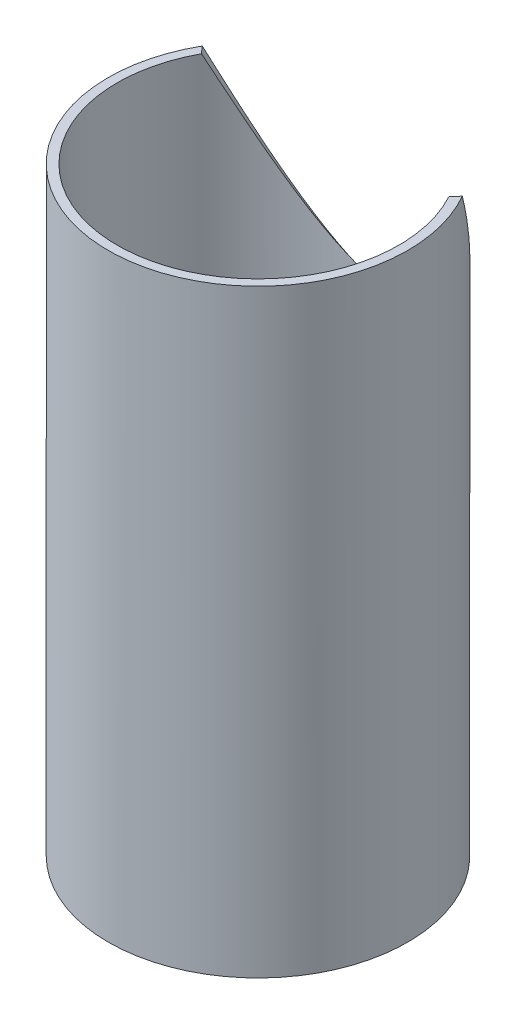
from build123d import *

# Parameters (mm, degrees)
EXTRUDE_1_OUTLINE_R      = 50
EXTRUDE_1_OUTLINE_R_2    = 47
EXTRUDE_1_DEPTH          = 200
CUT_EXTRUDE_1_DEPTH      = 213.132034356
CUT_EXTRUDE_1_DEPTH_BACK = 213.132034356
SKETCH_2_R               = 62.5


# Read off the part's stored shape, not the designer's step: Вытянуть-Тонкостенный1
with BuildPart() as part:
    # Вытянуть-Тонкостенный1 outline → Вытянуть-Тонкостенный1 (new body)
    with BuildSketch(Plane(origin=(0, 0, 0), x_dir=(1, 0, 0), z_dir=(0, 1, 0))):
        Circle(EXTRUDE_1_OUTLINE_R)
        Circle(EXTRUDE_1_OUTLINE_R_2, mode=Mode.SUBTRACT)
    extrude(amount=EXTRUDE_1_DEPTH)

    # Эскиз2 → Вырез-Вытянуть1 (cut, two sides: drawn at the far end of the back side and taken through both)
    with BuildSketch(Plane(origin=(0, 0, 0), x_dir=(1, 0, 0), z_dir=(0, -0.819152044288991, -0.5735764363510473)).offset(-CUT_EXTRUDE_1_DEPTH_BACK)):
        with Locations((0, -180)):
            Circle(SKETCH_2_R)
    extrude(amount=CUT_EXTRUDE_1_DEPTH + CUT_EXTRUDE_1_DEPTH_BACK, mode=Mode.SUBTRACT)


solid = part.part
